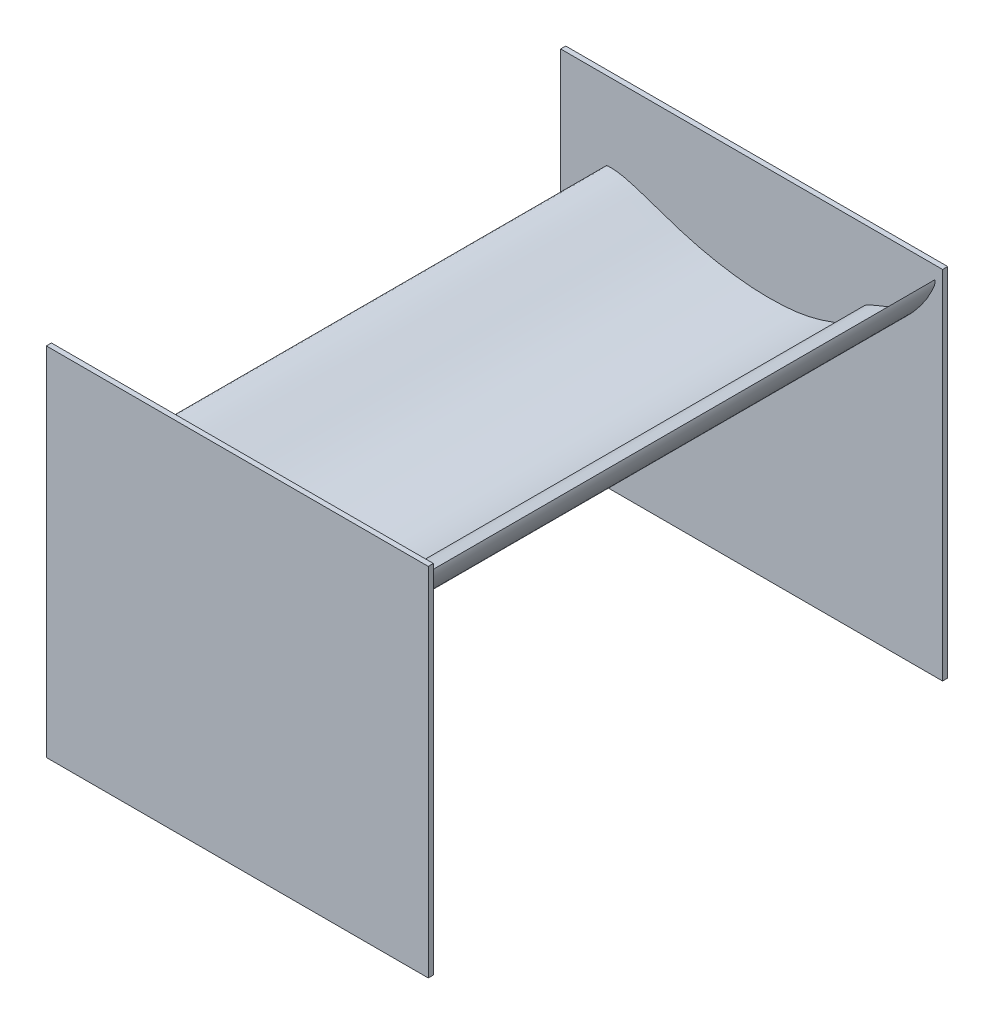
from build123d import *

# Parameters (mm, degrees)
BOSS_EXTRUDE4_DEPTH   = 1000
BOSS_EXTRUDE4_2_DEPTH = 1000
SKETCH8_4_W           = 750
SKETCH8_4_H           = 700
BOSS_EXTRUDE6_DEPTH   = 10


with BuildPart() as part:
    # Sketch8 → Boss-Extrude4 (new body)
    with BuildSketch(Plane.XY):
        with BuildLine():
            add(Edge.make_bspline(
                [(770.198118119, 1062.259241818), (769.701305806, 1061.855592471), (769.013734262, 1061.254504485), (768.259688956, 1060.495317562), (767.920903164, 1060.13829877), (767.755783208, 1059.919855836), (767.673405811, 1059.783131908), (767.615954982, 1059.654038886), (767.578896528, 1059.528663579), (767.558206739, 1059.387850727), (767.556309076, 1059.207331637), (767.589291871, 1058.935848115), (767.65777249, 1058.665370338), (767.775117144, 1058.293823157), (767.945283806, 1057.883350559), (768.236836796, 1057.377962401), (768.558253419, 1056.951341471), (769.029825075, 1056.431016217), (769.805988004, 1055.740739895), (770.88076266, 1055.006476422), (772.198257138, 1054.192573267), (773.629287204, 1053.425006603), (775.357955165, 1052.728553182), (777.230039259, 1052.157319616), (779.310151014, 1051.6977241), (781.600946098, 1051.36448618), (784.089202968, 1051.184755233), (786.746961343, 1051.171412936), (789.58245483, 1051.332724608), (792.621212362, 1051.67569195), (795.345209948, 1052.127772497), (798.218164875, 1052.728165061), (801.181325842, 1053.478029687), (804.693252311, 1054.560052353), (808.256376718, 1055.854097864), (811.86876529, 1057.36526172), (815.519702912, 1059.095887326), (818.118774276, 1060.471695327), (820.891639532, 1062.01564007), (823.86372967, 1063.762814464), (828.233140092, 1066.521813826), (832.898440303, 1069.643693971), (837.6894688, 1073.083495089), (842.31590209, 1076.661128416), (846.697243901, 1080.313515116), (850.948750037, 1084.107868545), (855.218188923, 1088.17276714), (859.498391769, 1092.513341822), (863.800703513, 1097.147328364), (868.096285963, 1102.045239462), (872.445947568, 1107.281652843), (876.868846096, 1112.891056644), (881.155095559, 1118.593140343), (885.156739262, 1124.201449227), (888.871742016, 1129.710935688), (892.368044678, 1135.241983639), (895.676803069, 1140.87159579), (898.725540685, 1146.454881231), (901.403499835, 1151.762824434), (903.646242779, 1156.54112861), (905.296684186, 1160.395012262), (906.462444001, 1163.386115624), (907.245566186, 1165.678693154), (907.763088271, 1167.643870655), (908.086189538, 1169.511233225), (908.203978227, 1171.48606669), (908.159331286, 1173.021283131), (907.862198798, 1176.190089383), (907.702598338, 1171.849092499), (907.206871232, 1169.873838922), (906.550481703, 1167.095079854), (905.684591422, 1164.542006792), (904.610723245, 1161.87033003), (903.188875156, 1158.827816131), (900.978092761, 1154.640530298), (898.366403502, 1149.994164146), (895.614224837, 1145.270796823), (893.121968904, 1141.361897745), (890.520482738, 1137.600790722), (887.770443465, 1133.969700171), (884.831746378, 1130.424607388), (881.76493491, 1127.038387691), (878.491542205, 1123.715586467), (874.883427373, 1120.292548327), (870.817653981, 1116.642658528), (866.362467881, 1112.891617458), (861.694639842, 1109.225888098), (856.780472006, 1105.637867929), (851.622489967, 1102.13208283), (846.152121196, 1098.657951427), (840.438844117, 1095.239942355), (834.524932038, 1091.915065638), (828.537598551, 1088.788764035), (822.599265657, 1085.928054508), (816.488574362, 1083.187351806), (809.894963351, 1080.414750263), (802.613361999, 1077.531645082), (795.383797513, 1074.774912576), (789.006149891, 1072.239809329), (784.051698374, 1070.119508043), (780.150758115, 1068.314468817), (776.968340282, 1066.68349692), (774.290202365, 1065.144255204), (772.075158568, 1063.697242963), (770.768231158, 1062.722446432), (770.198118119, 1062.259241818)],
                knots=[0, 0, 0, 0, 0.004864987, 0.006932545, 0.008137884, 0.008601497, 0.009011818, 0.009348653, 0.009673164, 0.01000266, 0.010427575, 0.011041817, 0.012076633, 0.012543472, 0.014004596, 0.015443582, 0.016968766, 0.018056068, 0.020779525, 0.024840634, 0.027935886, 0.032555454, 0.037166363, 0.042082108, 0.047421878, 0.05334819, 0.059667447, 0.066374566, 0.073542337, 0.08124902, 0.089615403, 0.094526367, 0.103562345, 0.112843808, 0.122455999, 0.132373756, 0.142605348, 0.153165588, 0.154726061, 0.166736317, 0.179371763, 0.194012659, 0.209411027, 0.224206692, 0.238469752, 0.252771691, 0.267526239, 0.283284172, 0.299113579, 0.315597401, 0.332811403, 0.350865811, 0.369905471, 0.387043716, 0.403243825, 0.420423249, 0.436786871, 0.45288503, 0.468782716, 0.481983436, 0.493011687, 0.500654809, 0.506381799, 0.511437541, 0.516043967, 0.520925914, 0.525830531, 0.529953559, 0.536609682, 0.543291188, 0.550106034, 0.557026955, 0.564113346, 0.571894396, 0.582580083, 0.60009418, 0.612424841, 0.624138462, 0.63533215, 0.647187483, 0.658759225, 0.670332543, 0.681912601, 0.694215176, 0.708142393, 0.723449252, 0.738488352, 0.753260173, 0.769704083, 0.785898216, 0.802525573, 0.820318822, 0.837475337, 0.85387235, 0.870428329, 0.888390886, 0.908253005, 0.929971274, 0.947220557, 0.960430628, 0.970941392, 0.97989584, 0.987611289, 0.994417222, 1, 1, 1, 1], degree=3))
        make_face()
    extrude(amount=BOSS_EXTRUDE4_DEPTH)



with BuildPart() as body_2:
    # Sketch8 → Boss-Extrude4 2 (new body)
    with BuildSketch(Plane.XY):
        with BuildLine():
            add(Edge.make_bspline(
                [(273.299712979, 1047.459241818), (271.501355354, 1047.497143149), (268.93533384, 1047.458620797), (265.939505315, 1047.202093246), (264.564566319, 1047.052713282), (263.81367442, 1046.884675527), (263.388633667, 1046.741384223), (263.03088237, 1046.569142357), (262.723591009, 1046.36780452), (262.423321423, 1046.103632175), (262.091158656, 1045.72021037), (261.66841919, 1045.078446799), (261.32358314, 1044.374320867), (260.899772696, 1043.364781846), (260.51841774, 1042.17581697), (260.224695763, 1040.562817074), (260.138135099, 1039.064345833), (260.203063122, 1037.092147862), (260.611872973, 1034.202128662), (261.580690993, 1030.675109668), (262.924936167, 1026.536268155), (264.596716896, 1022.290378011), (267.035615286, 1017.655929915), (270.009457863, 1013.029179995), (273.632028612, 1008.26358873), (277.935771872, 1003.3858749), (282.941696887, 998.478252721), (288.613294541, 993.61914713), (294.983232628, 988.811306858), (302.118947935, 984.023338085), (308.778415275, 980.041290493), (316.026672492, 976.106358714), (323.739917948, 972.327810126), (333.2329256, 968.263721419), (343.221010036, 964.560966366), (353.709288129, 961.233979805), (364.679055461, 958.30725875), (372.749680261, 956.531908465), (381.498353904, 954.801019637), (391.043359437, 953.143578783), (405.421970477, 951.114933646), (421.094244253, 949.326195386), (437.613792233, 947.99028136), (454.031107784, 947.248909838), (470.059032544, 947.113199491), (486.066732644, 947.517716421), (502.604583945, 948.469446244), (519.666548518, 949.992414415), (537.309174727, 952.104010926), (555.417065812, 954.793455282), (574.256086512, 958.110054986), (593.929976526, 962.092902134), (613.479460617, 966.522733281), (632.248568522, 971.268870235), (650.22376453, 976.32419444), (667.769452221, 981.823217486), (685.092355157, 987.874337914), (701.773807617, 994.298766739), (717.16020575, 1000.807003908), (730.651265058, 1006.971181907), (741.19281495, 1012.230748402), (749.127527913, 1016.522204009), (754.972629258, 1020.012096514), (759.653468518, 1023.283069105), (763.739864161, 1026.697776775), (767.581583798, 1030.71596392), (770.27617743, 1034.08723586), (775.398740276, 1041.418353385), (767.166879826, 1032.405229987), (762.514436029, 1029.07305067), (756.057294195, 1024.310883196), (749.56135823, 1020.413154308), (742.40414058, 1016.639248219), (733.827164964, 1012.703058476), (721.478784183, 1007.747404378), (707.436834403, 1002.536547933), (692.953850821, 997.416011511), (680.508215201, 993.568550593), (668.097102095, 990.236350557), (655.603931211, 987.452786364), (642.862749477, 985.196412287), (630.135759526, 983.513369064), (617.081308833, 982.341702283), (603.127332505, 981.563579542), (587.78024123, 981.131091145), (571.414754973, 981.189588102), (554.748610524, 981.817396349), (537.695772248, 983.059469228), (520.2698786, 984.920915856), (502.23203932, 987.417966685), (483.775625837, 990.476782521), (465.058500382, 994.099847319), (446.544938306, 998.281923252), (428.61910668, 1002.944130873), (410.54200743, 1008.176789085), (391.371985369, 1014.218797921), (370.526687937, 1021.274417907), (350.022594857, 1028.506289726), (331.747060736, 1034.664765282), (317.275489282, 1039.125525662), (305.634693026, 1042.347153894), (295.850133381, 1044.635901982), (287.313017908, 1046.204701663), (279.935988714, 1047.129478711), (275.363404042, 1047.415748446), (273.299712979, 1047.459241818)],
                knots=[0, 0, 0, 0, 0.004864987, 0.006932545, 0.008137884, 0.008601497, 0.009011818, 0.009348653, 0.009673164, 0.01000266, 0.010427575, 0.011041817, 0.012076633, 0.012543472, 0.014004596, 0.015443582, 0.016968766, 0.018056068, 0.020779525, 0.024840634, 0.027935886, 0.032555454, 0.037166363, 0.042082108, 0.047421878, 0.05334819, 0.059667447, 0.066374566, 0.073542337, 0.08124902, 0.089615403, 0.094526367, 0.103562345, 0.112843808, 0.122455999, 0.132373756, 0.142605348, 0.153165588, 0.154726061, 0.166736317, 0.179371763, 0.194012659, 0.209411027, 0.224206692, 0.238469752, 0.252771691, 0.267526239, 0.283284172, 0.299113579, 0.315597401, 0.332811403, 0.350865811, 0.369905471, 0.387043716, 0.403243825, 0.420423249, 0.436786871, 0.45288503, 0.468782716, 0.481983436, 0.493011687, 0.500654809, 0.506381799, 0.511437541, 0.516043967, 0.520925914, 0.525830531, 0.529953559, 0.536609682, 0.543291188, 0.550106034, 0.557026955, 0.564113346, 0.571894396, 0.582580083, 0.60009418, 0.612424841, 0.624138462, 0.63533215, 0.647187483, 0.658759225, 0.670332543, 0.681912601, 0.694215176, 0.708142393, 0.723449252, 0.738488352, 0.753260173, 0.769704083, 0.785898216, 0.802525573, 0.820318822, 0.837475337, 0.85387235, 0.870428329, 0.888390886, 0.908253005, 0.929971274, 0.947220557, 0.960430628, 0.970941392, 0.97989584, 0.987611289, 0.994417222, 1, 1, 1, 1], degree=3))
        make_face()
    extrude(amount=BOSS_EXTRUDE4_2_DEPTH)


with BuildPart() as part_1:
    add(part.part)

    add(body_2.part)  # Boss-Extrude6 merges body 2
    # Sketch8<4> → Boss-Extrude6 (add)
    with BuildSketch(Plane.XY):
        with Locations((548, 850)):
            Rectangle(SKETCH8_4_W, SKETCH8_4_H)
    boss_extrude6 = extrude(amount=-BOSS_EXTRUDE6_DEPTH)

    # Mirror1: Boss-Extrude6 across plane
    add(boss_extrude6.mirror(Plane.XY.offset(500)))


solid = part_1.part
